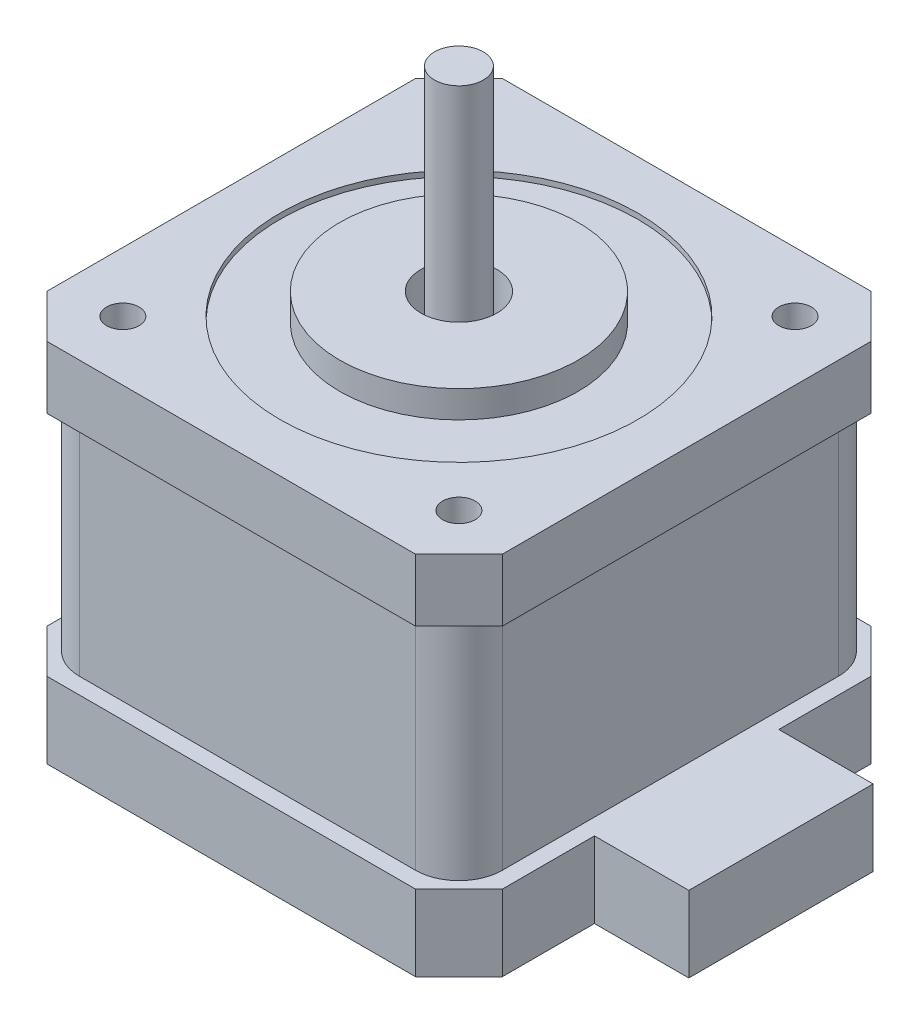
from build123d import *

# Parameters (mm, degrees)
SKETCH2_W                   = 42
SKETCH2_H                   = 42
MAIN_BOSS_DEPTH             = 33.75
SKETCH4_W                   = 8.7
SKETCH4_H                   = 17
SIDE_EXTRUDE_DEPTH          = 10
SKETCH5_R                   = 16.5
BIG_CIRCLE_CUT_DEPTH        = 0.5
SKETCH6_R                   = 11
MEDIUM_CIRCLE_EXTRUDE_DEPTH = 2.5
SKETCH7_R                   = 3.5
SMALL_CIRCLE_CUT_DEPTH      = 5
SKETCH8_R                   = 2.25
CIRCULAR_TALL_EXTRUDE_DEPTH = 23
SIDE_EDGE_CUT_DEPTH         = 50.62008162
MIRROR2_DEPTH               = 33.75
SKETCH10_R                  = 1.5
F_4_HOLES_DEPTH             = 5
MIRROR4_COPY_1_SKETCH_R     = 1.5
MIRROR4_COPY_1_DEPTH        = 5
MIRROR6_COPY_1_SKETCH_R     = 1.5
MIRROR6_COPY_1_DEPTH        = 5
MIRROR6_COPY_2_SKETCH_R     = 1.5
MIRROR6_COPY_2_DEPTH        = 5
MIRROR6_COPY_3_SKETCH_R     = 1.5
MIRROR6_COPY_3_DEPTH        = 5
SKETCH12_OUTSIDE_W          = 69.698
SKETCH12_OUTSIDE_H          = 60.998
CUT_AROUND_BODY_DEPTH       = 21


# Read off the part's stored shape, not the designer's step: Mirror2
with BuildPart() as part:
    # Sketch2 → Main Boss (new body)
    with BuildSketch(Plane(origin=(0, 0, 0), x_dir=(1, 0, 0), z_dir=(0, 1, 0))):
        Rectangle(SKETCH2_W, SKETCH2_H)
    extrude(amount=MAIN_BOSS_DEPTH)

    # Sketch4 → side extrude (add)
    with BuildSketch(Plane(origin=(0, 0, 0), x_dir=(1, 0, 0), z_dir=(0, 1, 0))):
        with Locations((25.35, 0)):
            Rectangle(SKETCH4_W, SKETCH4_H)
    extrude(amount=SIDE_EXTRUDE_DEPTH)

    # Sketch5 → Big circle cut (cut)
    with BuildSketch(Plane(origin=(0, 33.75, 0), x_dir=(1, 0, 0), z_dir=(0, 1, 0))):
        with Locations(Location((0, 0, 0), (0, 0, 270))):
            Circle(SKETCH5_R)
    extrude(amount=-BIG_CIRCLE_CUT_DEPTH, mode=Mode.SUBTRACT)

    # Sketch6 → medium circle extrude (add)
    with BuildSketch(Plane(origin=(0, 33.25, 0), x_dir=(1, 0, 0), z_dir=(0, 1, 0))):
        with Locations(Location((0, 0, 0), (0, 0, 270))):
            Circle(SKETCH6_R)
    extrude(amount=MEDIUM_CIRCLE_EXTRUDE_DEPTH)

    # Sketch7 → small circle cut (cut)
    with BuildSketch(Plane(origin=(0, 35.75, 0), x_dir=(1, 0, 0), z_dir=(0, 1, 0))):
        with Locations(Location((0, 0, 0), (0, 0, 270))):
            Circle(SKETCH7_R)
    extrude(amount=-SMALL_CIRCLE_CUT_DEPTH, mode=Mode.SUBTRACT)

    # Sketch8 → circular tall extrude (add)
    with BuildSketch(Plane(origin=(0, 30.75, 0), x_dir=(1, 0, 0), z_dir=(0, 1, 0))):
        with Locations(Location((0, 0, 0), (0, 0, 270))):
            Circle(SKETCH8_R)
    extrude(amount=CIRCULAR_TALL_EXTRUDE_DEPTH)

    # Sketch9 → side edge cut (cut, symmetric)
    with BuildSketch(Plane(origin=(0, 33.75, 0), x_dir=(1, 0, 0), z_dir=(0, 1, 0))):
        Polygon((79.674907888, 117.679754574), (-17.004846686, 21), (-21, 17.004846686), (-117.679754574, -79.674907888), (-311.039263723, 113.684601261), (-113.684601261, 311.039263723), align=None)
    side_edge_cut = extrude(amount=SIDE_EDGE_CUT_DEPTH, both=True, mode=Mode.SUBTRACT)

    # Mirror1: side edge cut across plane
    add(side_edge_cut.mirror(Plane.XY), mode=Mode.SUBTRACT)

    # Mirror2 outline → Mirror2 (cut)
    with BuildSketch(Plane(origin=(0, 0, 0), x_dir=(1, 0, 0), z_dir=(0, 1, 0))):
        Polygon((21, -21), (21, -17.004846686), (17.004846686, -21), align=None)
        Polygon((17.004846686, 21), (21, 17.004846686), (21, 21), align=None)
    extrude(amount=MIRROR2_DEPTH, mode=Mode.SUBTRACT)

    # Sketch10 → 4 holes (cut)
    with BuildSketch(Plane(origin=(0, 33.75, 0), x_dir=(1, 0, 0), z_dir=(0, 1, 0))):
        with Locations(Location((-15.5, 15.5, 0), (0, 0, 270))):
            Circle(SKETCH10_R)
    f_4_holes = extrude(amount=-F_4_HOLES_DEPTH, mode=Mode.SUBTRACT)

    # Mirror3: 4 holes across plane
    add(f_4_holes.mirror(Plane.XY), mode=Mode.SUBTRACT)

    # Mirror4: 4 holes across plane
    add(f_4_holes.mirror(Plane(origin=(0, 0, 0), x_dir=(0, 0, 1), z_dir=(1, 0, 0))), mode=Mode.SUBTRACT)

    # Mirror4 copy 1 sketch → Mirror4 copy 1 (cut)
    with BuildSketch(Plane(origin=(0, 33.75, 0), x_dir=(-1, 0, 0), z_dir=(0, 1, 0))):
        with Locations(Location((-15.5, 15.5, 0), (0, 0, 270))):
            Circle(MIRROR4_COPY_1_SKETCH_R)
    extrude(amount=-MIRROR4_COPY_1_DEPTH, mode=Mode.SUBTRACT)

    # Mirror6: 4 holes across plane
    add(f_4_holes.mirror(Plane.ZX.offset(16.875)), mode=Mode.SUBTRACT)

    # Mirror6 copy 1 sketch → Mirror6 copy 1 (cut)
    with BuildSketch(Plane.XZ):
        with Locations(Location((-15.5, 15.5, 0), (0, 0, 270))):
            Circle(MIRROR6_COPY_1_SKETCH_R)
    extrude(amount=-MIRROR6_COPY_1_DEPTH, mode=Mode.SUBTRACT)

    # Mirror6 copy 2 sketch → Mirror6 copy 2 (cut)
    with BuildSketch(Plane(origin=(0, 0, 0), x_dir=(-1, 0, 0), z_dir=(0, -1, 0))):
        with Locations(Location((-15.5, 15.5, 0), (0, 0, 270))):
            Circle(MIRROR6_COPY_2_SKETCH_R)
    extrude(amount=-MIRROR6_COPY_2_DEPTH, mode=Mode.SUBTRACT)

    # Mirror6 copy 3 sketch → Mirror6 copy 3 (cut)
    with BuildSketch(Plane(origin=(0, 0, 0), x_dir=(-1, 0, 0), z_dir=(0, -1, 0))):
        with Locations((-15.5, -15.5)):
            Circle(MIRROR6_COPY_3_SKETCH_R)
    extrude(amount=-MIRROR6_COPY_3_DEPTH, mode=Mode.SUBTRACT)

    # Sketch12 outside → cut around body (cut)
    with BuildSketch(Plane(origin=(0, 7, 0), x_dir=(1, 0, 0), z_dir=(0, 1, 0))):
        with Locations((4.35, 0)):
            Rectangle(SKETCH12_OUTSIDE_W, SKETCH12_OUTSIDE_H)
        with BuildLine():
            Line((-15.5, -19.5), (15.5, -19.5))
            ThreePointArc((15.5, -19.5), (18.328427125, -18.328427125), (19.5, -15.5))
            Line((19.5, -15.5), (19.5, 15.5))
            ThreePointArc((19.5, 15.5), (18.328427125, 18.328427125), (15.5, 19.5))
            Line((15.5, 19.5), (-15.5, 19.5))
            ThreePointArc((-15.5, 19.5), (-18.328427125, 18.328427125), (-19.5, 15.5))
            Line((-19.5, 15.5), (-19.5, -15.5))
            ThreePointArc((-19.5, -15.5), (-18.328427125, -18.328427125), (-15.5, -19.5))
        make_face(mode=Mode.SUBTRACT)
    extrude(amount=CUT_AROUND_BODY_DEPTH, mode=Mode.SUBTRACT)


solid = part.part
